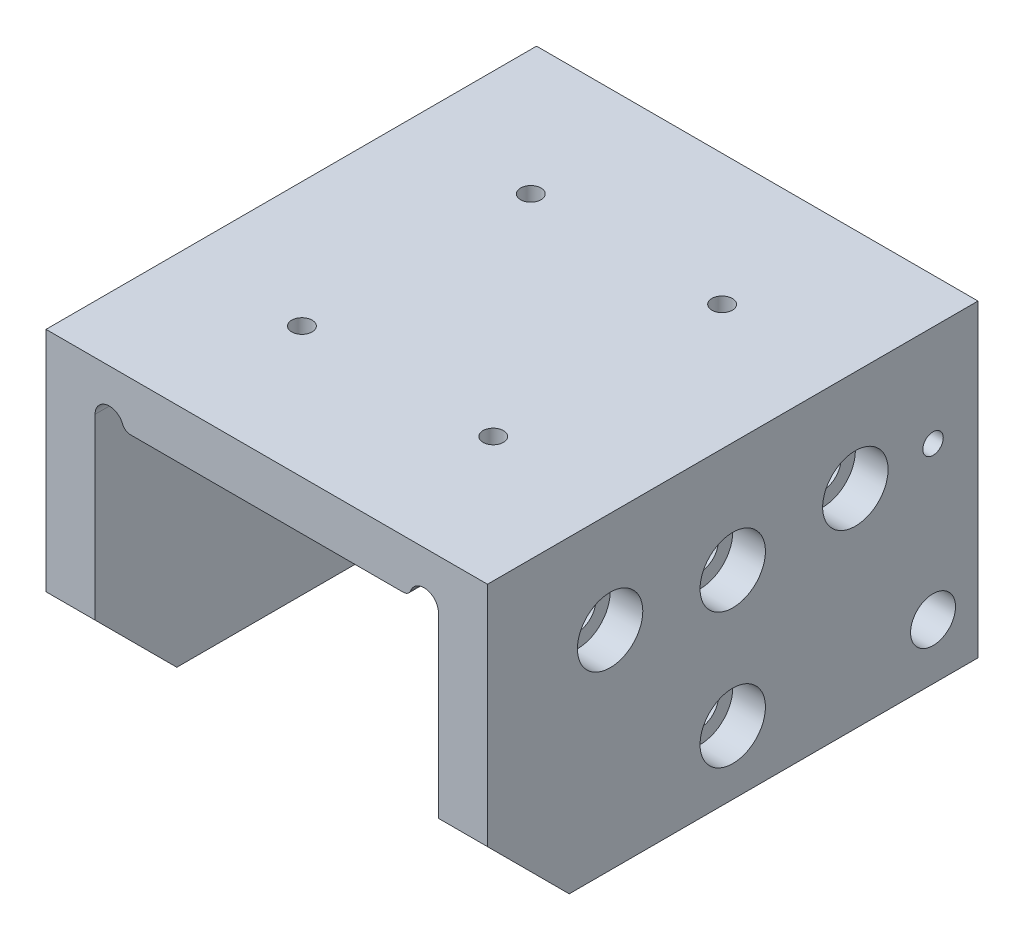
from build123d import *

# Parameters (mm, degrees)
SKETCH1_W                      = 54
SKETCH1_H                      = 37.8
BOSS_EXTRUDE1_DEPTH            = 30
SKETCH2_W                      = 42
SKETCH2_H                      = 31.8
CUT_EXTRUDE1_DEPTH             = 76.88043226
CBORE_FOR_M4_SHCS1_D           = 4.5
CBORE_FOR_M4_SHCS1_DEPTH       = 6
CBORE_FOR_M4_SHCS1_CBORE_D     = 8
CBORE_FOR_M4_SHCS1_CBORE_DEPTH = 4
M3X0_5_START                   = 31.8
M3X0_5_TAPPED_HOLE_OUTLINE_R   = 1.25
M3X0_5_TAPPED_HOLE_DEPTH       = 6
CHAMFER1_SIZE                  = 10
M5_CLEARANCE_HOLE1_D           = 5.5
M3X0_5_TAPPED_HOLE1_D          = 2.5
M3X0_5_TAPPED_HOLE1_DEPTH      = 6
SKETCH11_R                     = 1.75
CUT_EXTRUDE2_DEPTH             = 76.88043226
FILLET1_R                      = 1


# Read off the part's stored shape, not the designer's step: M3x0.5 Tapped Hole
with BuildPart() as part:
    # Sketch1 → Boss-Extrude1 (new, symmetric)
    with BuildSketch(Plane.XY):
        with Locations((0, 18.9)):
            Rectangle(SKETCH1_W, SKETCH1_H)
    extrude(amount=BOSS_EXTRUDE1_DEPTH, both=True)

    # Sketch2 → Cut-Extrude1 (cut, through all)
    with BuildSketch(Plane.XY.offset(30)):
        with Locations((0, 15.9)):
            Rectangle(SKETCH2_W, SKETCH2_H)
    extrude(amount=-CUT_EXTRUDE1_DEPTH, mode=Mode.SUBTRACT)

    # CBORE for M4 SHCS1
    with Locations(Plane.ZY.offset(27)):
        with Locations((15, 25.45), (0, 24.3), (0, 7.8), (-15, 25.45)):
            cbore_for_m4_shcs1 = CounterBoreHole(CBORE_FOR_M4_SHCS1_D / 2, CBORE_FOR_M4_SHCS1_CBORE_D / 2, CBORE_FOR_M4_SHCS1_CBORE_DEPTH, depth=CBORE_FOR_M4_SHCS1_DEPTH)

    # M3x0.5 Tapped Hole outline → M3x0.5 Tapped Hole (cut)
    with BuildSketch(Plane(origin=(0, 0, 0), x_dir=(1, 0, 0), z_dir=(0, 1, 0)).offset(M3X0_5_START)):
        with Locations((11.7, -14)):
            Circle(M3X0_5_TAPPED_HOLE_OUTLINE_R)
        with Locations((-11.7, 14)):
            Circle(M3X0_5_TAPPED_HOLE_OUTLINE_R)
        with Locations((-11.7, -14)):
            Circle(M3X0_5_TAPPED_HOLE_OUTLINE_R)
        with Locations((11.7, 14)):
            Circle(M3X0_5_TAPPED_HOLE_OUTLINE_R)
    extrude(amount=M3X0_5_TAPPED_HOLE_DEPTH, mode=Mode.SUBTRACT)

    # Chamfer1
    chamfer1_edges = [part.edges().sort_by_distance(p)[0] for p in [
        (24, 0, 30),
        (-24, 0, 30),
    ]]
    chamfer(chamfer1_edges, length=CHAMFER1_SIZE)

    # Mirror1: CBORE for M4 SHCS1 across plane
    add(cbore_for_m4_shcs1.mirror(Plane(origin=(0, 0, 0), x_dir=(0, 0, 1), z_dir=(1, 0, 0))), mode=Mode.SUBTRACT)

    # M5 Clearance Hole1 (through all)
    with Locations(Plane(origin=(27, 0, 0), x_dir=(0, 0, -1), z_dir=(1, 0, 0))):
        with Locations((24.5, 6.8)):
            Hole(M5_CLEARANCE_HOLE1_D / 2)

    # M3x0.5 Tapped Hole1
    with Locations(Plane(origin=(27, 0, 0), x_dir=(0, 0, -1), z_dir=(1, 0, 0))):
        with Locations((24.5, 25.45)):
            Hole(M3X0_5_TAPPED_HOLE1_D / 2, depth=M3X0_5_TAPPED_HOLE1_DEPTH)

    # Sketch11 → Cut-Extrude2 (cut, through all)
    with BuildSketch(Plane(origin=(0, 0, -30), x_dir=(-1, 0, 0), z_dir=(0, 0, -1))):
        with Locations((-19.25, 31.8)):
            Circle(SKETCH11_R)
        with Locations((19.25, 31.8)):
            Circle(SKETCH11_R)
    extrude(amount=-CUT_EXTRUDE2_DEPTH, mode=Mode.SUBTRACT)

    # Fillet1
    fillet1_edges = [part.edges().sort_by_distance(p)[0] for p in [
        (-17.5, 31.8, 0),
        (17.5, 31.8, 0),
    ]]
    fillet(fillet1_edges, radius=FILLET1_R)


solid = part.part
